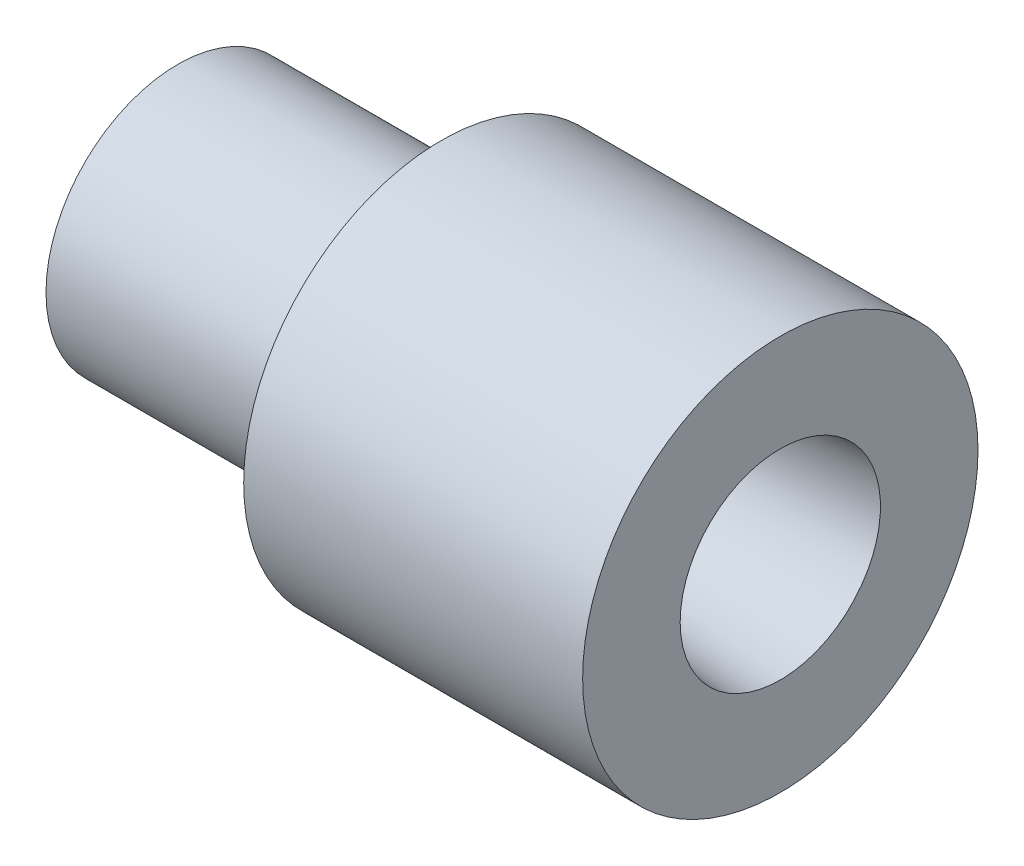
from build123d import *


with BuildPart() as part:
    # Sketch1 → Revolve1 (revolve)
    with BuildSketch(Plane(origin=(0, 0, 0), x_dir=(1, 0, 0), z_dir=(0, 1, 0))):
        Polygon((0, 2.286), (0, 6.35), (12.7, 6.35), (12.7, 9.525), (29.032332849, 9.525), (29.032332849, 4.826), align=None)
    revolve(axis=Axis((0, 0, 0), (1, 0, 0)))


solid = part.part
